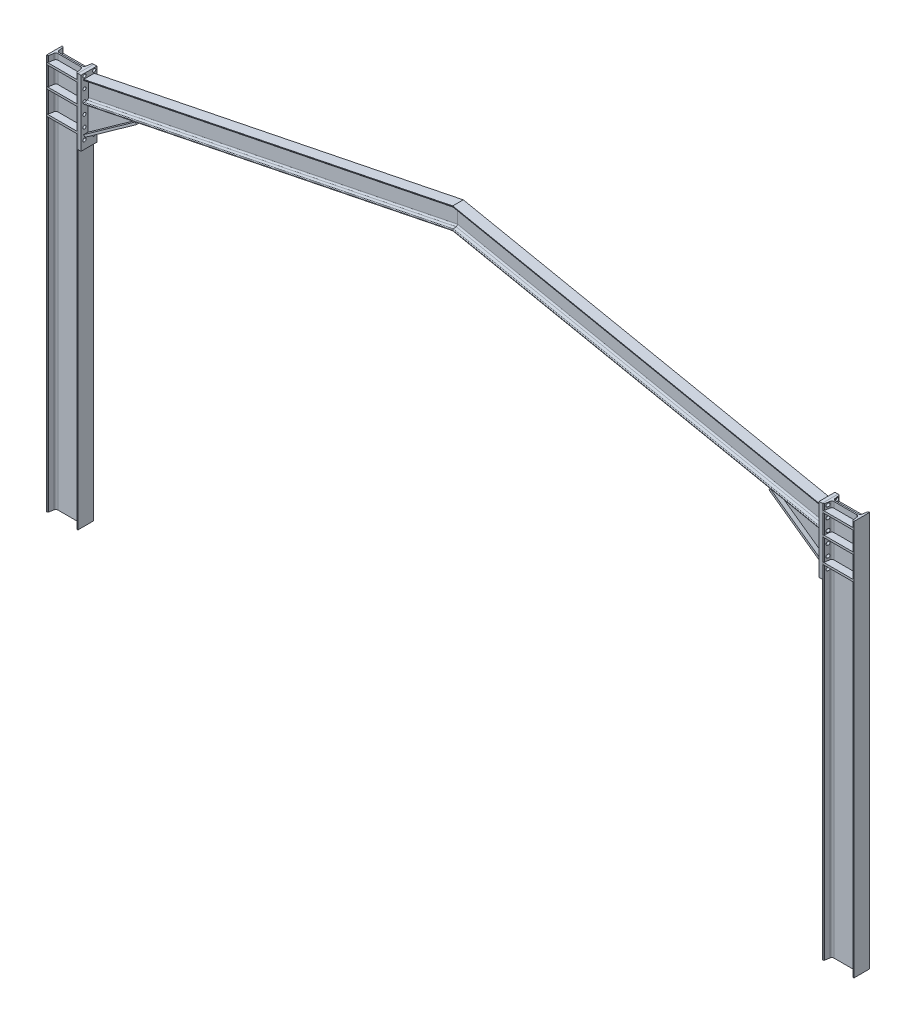
from build123d import *

# Parameters (mm, degrees)
SB_BEAM_120_X_12_1_DEPTH = 1500
SKETCH14_W               = 60
SKETCH14_H               = 250
BASE_FLANGE1_DEPTH       = 12
SB_START                 = -329.356977787
SB_BEAM_80_X_6_1_DEPTH   = 1530.593395901
GUSSET1_START            = -4
GUSSET1_DEPTH            = 8
BASE_FLANGE2_DEPTH       = 8
SKETCH24_R               = 6
CUT_EXTRUDE2_DEPTH       = 59
SKETCH25_W               = 60
SKETCH25_H               = 250
BASE_FLANGE3_DEPTH       = 12
SKETCH31_R               = 6
CUT_EXTRUDE3_DEPTH       = 59
BASE_FLANGE4_DEPTH       = 8
SKETCH37_W               = 116.160141669
SKETCH37_H               = 60
BOSS_EXTRUDE1_DEPTH      = 8
SKETCH39_W               = 117.120106252
SKETCH39_H               = 60
BOSS_EXTRUDE2_DEPTH      = 8
SKETCH40_W               = 116.160141669
SKETCH40_H               = 60
BOSS_EXTRUDE3_DEPTH      = 8
SKETCH41_W               = 116.160141669
SKETCH41_H               = 60
BOSS_EXTRUDE4_DEPTH      = 8
SKETCH42_W               = 116.160141669
SKETCH42_H               = 60
BOSS_EXTRUDE5_DEPTH      = 8
SKETCH43_W               = 116.160141669
SKETCH43_H               = 60
BOSS_EXTRUDE6_DEPTH      = 8


# Read off the part's stored shape, not the designer's step: Sb beam 80 X 6(1), Gusset1
# Sheet-metal steps are written as plain solids
with BuildPart() as part:
    # Sketch13 → Sb beam 120 X 12(1) (new body)
    with BuildSketch(Plane(origin=(-504.910714286, 577.232142857, 0), x_dir=(0, 0, 1), z_dir=(0, -1, 0))):
        with BuildLine():
            Line((-30, -60), (-30, -58.080070835))
            ThreePointArc((-30, -58.080070835), (-29.052095223, -55.494589303), (-26.657642624, -54.134502919))
            Line((-26.657642624, -54.134502919), (-9.184714752, -51.222135832))
            ThreePointArc((-9.184714752, -51.222135832), (-4.395809555, -48.501963064), (-2.5, -43.331))
            Line((-2.5, -43.331), (-2.5, 43.331))
            ThreePointArc((-2.5, 43.331), (-4.395809555, 48.501963064), (-9.184714752, 51.222135832))
            Line((-9.184714752, 51.222135832), (-26.657642624, 54.134502919))
            ThreePointArc((-26.657642624, 54.134502919), (-29.052095223, 55.494589303), (-30, 58.080070835))
            Line((-30, 58.080070835), (-30, 60))
            Line((-30, 60), (30, 60))
            Line((30, 60), (30, 58.080070835))
            ThreePointArc((30, 58.080070835), (29.052095223, 55.494589303), (26.657642624, 54.134502919))
            Line((26.657642624, 54.134502919), (9.184714752, 51.222135832))
            ThreePointArc((9.184714752, 51.222135832), (4.395809555, 48.501963064), (2.5, 43.331))
            Line((2.5, 43.331), (2.5, -43.331))
            ThreePointArc((2.5, -43.331), (4.395809555, -48.501963064), (9.184714752, -51.222135832))
            Line((9.184714752, -51.222135832), (26.657642624, -54.134502919))
            ThreePointArc((26.657642624, -54.134502919), (29.052095223, -55.494589303), (30, -58.080070835))
            Line((30, -58.080070835), (30, -60))
            Line((30, -60), (-30, -60))
        make_face()
    extrude(amount=SB_BEAM_120_X_12_1_DEPTH)


with BuildPart() as body_2:
    # Sketch14 → Base-Flange1 (new body)
    with BuildSketch(Plane(origin=(-432.910714286, 0, 0), x_dir=(0, 0, -1), z_dir=(1, 0, 0))):
        with Locations((0, 452.232142857)):
            Rectangle(SKETCH14_W, SKETCH14_H)
    extrude(amount=-BASE_FLANGE1_DEPTH)


with BuildPart() as body_3:
    # Sb beam 80 X 6(1) outline → Sb beam 80 X 6(1) (new body)
    with BuildSketch(Plane(origin=(0, 0, 0), x_dir=(-0.19893804445003002, 0.9800120685330349, 0), z_dir=(0.980012068533035, 0.19893804445003, 0)).offset(SB_START)):
        with BuildLine():
            Line((633.624127064, -20), (633.624127064, 20))
            Line((633.624127064, 20), (631.665587275, 20))
            ThreePointArc((631.665587275, 20), (629.726476126, 19.289071417), (628.706411338, 17.493231968))
            Line((628.706411338, 17.493231968), (626.959667938, 7.013536064))
            ThreePointArc((626.959667938, 7.013536064), (624.919538362, 3.421857166), (621.041316064, 2))
            Line((621.041316064, 2), (566.206938064, 2))
            ThreePointArc((566.206938064, 2), (562.328715766, 3.421857166), (560.28858619, 7.013536064))
            Line((560.28858619, 7.013536064), (558.541842791, 17.493231968))
            ThreePointArc((558.541842791, 17.493231968), (557.521778003, 19.289071417), (555.582666854, 20))
            Line((555.582666854, 20), (553.624127064, 20))
            Line((553.624127064, 20), (553.624127064, -20))
            Line((553.624127064, -20), (555.582666854, -20))
            ThreePointArc((555.582666854, -20), (557.521778003, -19.289071417), (558.541842791, -17.493231968))
            Line((558.541842791, -17.493231968), (560.28858619, -7.013536064))
            ThreePointArc((560.28858619, -7.013536064), (562.328715766, -3.421857166), (566.206938064, -2))
            Line((566.206938064, -2), (621.041316064, -2))
            ThreePointArc((621.041316064, -2), (624.919538362, -3.421857166), (626.959667938, -7.013536064))
            Line((626.959667938, -7.013536064), (628.706411338, -17.493231968))
            ThreePointArc((628.706411338, -17.493231968), (629.726476126, -19.289071417), (631.665587275, -20))
            Line((631.665587275, -20), (633.624127064, -20))
        make_face()
    extrude(amount=SB_BEAM_80_X_6_1_DEPTH)


with BuildPart() as body_4:
    # Gusset1 outline → Gusset1 (new body)
    with BuildSketch(Plane.XY.offset(GUSSET1_START)):
        Polygon((-432.910714286, 377.036692867), (-236.908300579, 516.824301757), (-432.910714286, 477.036692867), align=None)
    extrude(amount=GUSSET1_DEPTH)


with BuildPart() as body_5:
    # Sketch21 → Base-Flange2 (new body)
    with BuildSketch(Plane(origin=(-324.196799642, 454.570728768, 0), x_dir=(0.8141539158451343, 0.5806491206520803, 3.7979502140957525e-15), z_dir=(0.5806491206520803, -0.8141539158451343, -5.325274643520372e-15))):
        Polygon((107.213755734, 4), (107.213755734, 20), (-133.52992908, 20), (-133.52992908, 4), (-133.52992908, -20), (107.213755734, -20), align=None)
    extrude(amount=BASE_FLANGE2_DEPTH)


with BuildPart() as cut_extrude2_tool:
    # Sketch24 → Cut-Extrude2 (new body)
    with BuildSketch(Plane(origin=(-432.910714286, 0, 0), x_dir=(0, 0, -1), z_dir=(1, 0, 0))):
        with Locations((-17, 568.152304318)):
            Circle(SKETCH24_R)
        with Locations((20, 568.152304318)):
            Circle(SKETCH24_R)
        with Locations((-17, 526.152304318)):
            Circle(SKETCH24_R)
        with Locations((-17, 484.152304318)):
            Circle(SKETCH24_R)
        with Locations((-17, 442.152304318)):
            Circle(SKETCH24_R)
        with Locations((-17, 400.152304318)):
            Circle(SKETCH24_R)
        with Locations((-17, 358.152304318)):
            Circle(SKETCH24_R)
        with Locations((20, 526.152304318)):
            Circle(SKETCH24_R)
        with Locations((20, 484.152304318)):
            Circle(SKETCH24_R)
        with Locations((20, 442.152304318)):
            Circle(SKETCH24_R)
        with Locations((20, 400.152304318)):
            Circle(SKETCH24_R)
        with Locations((20, 358.152304318)):
            Circle(SKETCH24_R)
    extrude(amount=-CUT_EXTRUDE2_DEPTH)


with BuildPart() as part_1:
    add(part.part)

    # Cut-Extrude2: cut by cut_extrude2_tool
    add(cut_extrude2_tool.part, mode=Mode.SUBTRACT)


with BuildPart() as body_2_1:
    add(body_2.part)

    # Cut-Extrude2: cut by cut_extrude2_tool
    add(cut_extrude2_tool.part, mode=Mode.SUBTRACT)


with BuildPart() as body_3_1:
    add(body_3.part)

    # Cut-Extrude2: cut by cut_extrude2_tool
    add(cut_extrude2_tool.part, mode=Mode.SUBTRACT)


with BuildPart() as body_6:
    # Mirror1: mirrored copy
    add(part_1.part.mirror(Plane(origin=(967.089285714, 0, 0), x_dir=(0, 0, 1), z_dir=(1, 0, 0))))


with BuildPart() as body_7:
    # Sketch25 → Base-Flange3 (new body)
    with BuildSketch(Plane.ZY.offset(-2379.089285714)):
        with Locations((0, 452.232142857)):
            Rectangle(SKETCH25_W, SKETCH25_H)
    extrude(amount=BASE_FLANGE3_DEPTH)


with BuildPart() as cut_extrude3_tool:
    # Sketch31 → Cut-Extrude3 (new body)
    with BuildSketch(Plane.ZY.offset(-2367.089285714)):
        with Locations((-17, 568.152142857)):
            Circle(SKETCH31_R)
        with Locations((15, 568.152142857)):
            Circle(SKETCH31_R)
        with Locations((-17, 526.152142857)):
            Circle(SKETCH31_R)
        with Locations((-17, 484.152142857)):
            Circle(SKETCH31_R)
        with Locations((-17, 442.152142857)):
            Circle(SKETCH31_R)
        with Locations((-17, 400.152142857)):
            Circle(SKETCH31_R)
        with Locations((-17, 358.152142857)):
            Circle(SKETCH31_R)
        with Locations((15, 526.152142857)):
            Circle(SKETCH31_R)
        with Locations((15, 484.152142857)):
            Circle(SKETCH31_R)
        with Locations((15, 442.152142857)):
            Circle(SKETCH31_R)
        with Locations((15, 400.152142857)):
            Circle(SKETCH31_R)
        with Locations((15, 358.152142857)):
            Circle(SKETCH31_R)
    extrude(amount=-CUT_EXTRUDE3_DEPTH)


with BuildPart() as body_6_1:
    add(body_6.part)

    # Cut-Extrude3: cut by cut_extrude3_tool
    add(cut_extrude3_tool.part, mode=Mode.SUBTRACT)


with BuildPart() as body_7_1:
    add(body_7.part)

    # Cut-Extrude3: cut by cut_extrude3_tool
    add(cut_extrude3_tool.part, mode=Mode.SUBTRACT)


with BuildPart() as body_8:
    # Mirror2: mirrored copy
    add(body_4.part.mirror(Plane(origin=(967.089285714, 0, 0), x_dir=(0, 0, 1), z_dir=(1, 0, 0))))


with BuildPart() as body_9:
    # Mirror2 2: mirrored copy
    add(body_3_1.part.mirror(Plane(origin=(967.089285714, 0, 0), x_dir=(0, 0, 1), z_dir=(1, 0, 0))))

    # Trim/Extend1
    split(bisect_by=Plane(origin=(967.089285714, 802.047132018, -0.0001078), x_dir=(0, 1, 0), z_dir=(1, 0, 0)), keep=Keep.TOP)


with BuildPart() as body_10:
    # Sketch34 → Base-Flange4 (new body)
    with BuildSketch(Plane(origin=(976.311683748, 1368.929964996, 0), x_dir=(0.8141539158451343, -0.5806491206520803, -1.2226885002572106e-14), z_dir=(-0.5806491206520803, -0.8141539158451343, -1.7143858398085674e-14))):
        Polygon((1467.505302138, 0), (1467.505302138, 20), (1708.248986953, 20), (1708.248986953, 0), (1708.248986953, -20), (1467.505302138, -20), align=None)
    extrude(amount=BASE_FLANGE4_DEPTH)


with BuildPart() as body_3_2:
    add(body_3_1.part)

    # Trim/Extend1
    split(bisect_by=Plane(origin=(967.089285714, 802.047132018, -0.0001078), x_dir=(0, -1, 0), z_dir=(-1, 0, 0)), keep=Keep.TOP)


with BuildPart() as body_11:
    # Sketch37 → Boss-Extrude1 (new body)
    with BuildSketch(Plane(origin=(0, 377.232142857, 0), x_dir=(1, 0, 0), z_dir=(0, 1, 0))):
        with Locations((2439.089285714, 0)):
            Rectangle(SKETCH37_W, SKETCH37_H)
    extrude(amount=BOSS_EXTRUDE1_DEPTH)


with BuildPart() as body_12:
    # Sketch39 → Boss-Extrude2 (new body)
    with BuildSketch(Plane(origin=(0, 467.232142857, 0), x_dir=(1, 0, 0), z_dir=(0, 1, 0))):
        with Locations((2439.569268006, 0)):
            Rectangle(SKETCH39_W, SKETCH39_H)
    extrude(amount=BOSS_EXTRUDE2_DEPTH)


with BuildPart() as body_13:
    # Sketch40 → Boss-Extrude3 (new body)
    with BuildSketch(Plane(origin=(0, 547.232142857, 0), x_dir=(1, 0, 0), z_dir=(0, 1, 0))):
        with Locations((2439.089285714, 0)):
            Rectangle(SKETCH40_W, SKETCH40_H)
    extrude(amount=BOSS_EXTRUDE3_DEPTH)


with BuildPart() as body_14:
    # Sketch41 → Boss-Extrude4 (new body)
    with BuildSketch(Plane(origin=(0, 377.232142857, 0), x_dir=(1, 0, 0), z_dir=(0, 1, 0))):
        with Locations((-504.910714286, 0)):
            Rectangle(SKETCH41_W, SKETCH41_H)
    extrude(amount=BOSS_EXTRUDE4_DEPTH)


with BuildPart() as body_15:
    # Sketch42 → Boss-Extrude5 (new body)
    with BuildSketch(Plane(origin=(0, 467.232142857, 0), x_dir=(1, 0, 0), z_dir=(0, 1, 0))):
        with Locations((-504.910714286, 0)):
            Rectangle(SKETCH42_W, SKETCH42_H)
    extrude(amount=BOSS_EXTRUDE5_DEPTH)


with BuildPart() as body_16:
    # Sketch43 → Boss-Extrude6 (new body)
    with BuildSketch(Plane(origin=(0, 547.232142857, 0), x_dir=(1, 0, 0), z_dir=(0, 1, 0))):
        with Locations((-504.910714286, 0)):
            Rectangle(SKETCH43_W, SKETCH43_H)
    extrude(amount=BOSS_EXTRUDE6_DEPTH)


solid = Compound([body_4.part, body_5.part, part_1.part, body_2_1.part, body_6_1.part, body_7_1.part, body_8.part, body_9.part, body_10.part, body_3_2.part, body_11.part, body_12.part, body_13.part, body_14.part, body_15.part, body_16.part])
